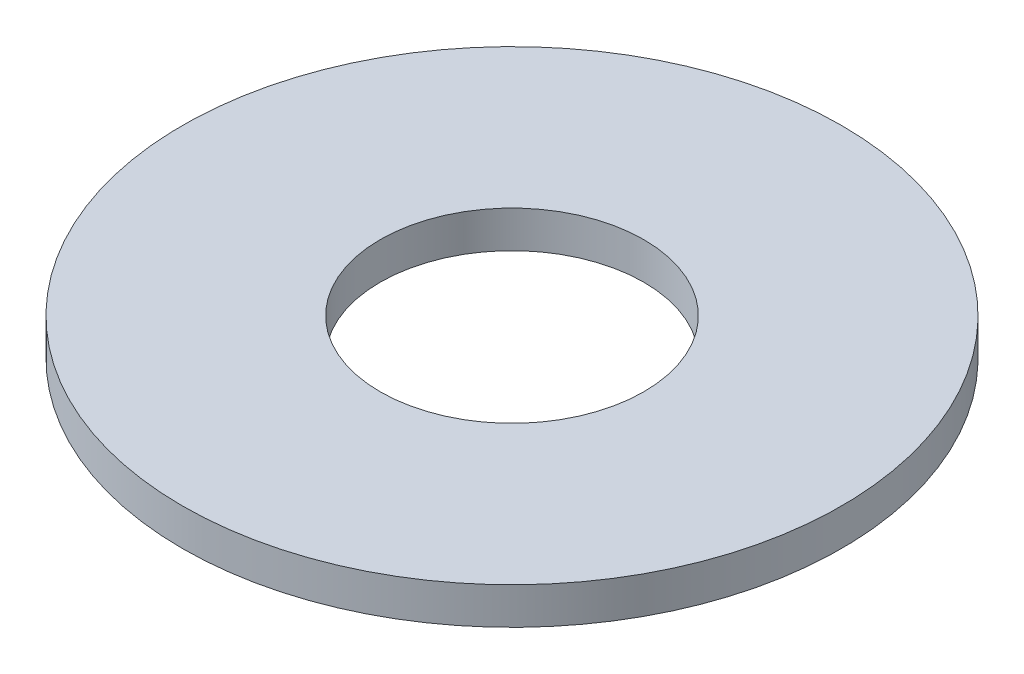
from build123d import *

# Parameters (mm, degrees)
SKETCH1_R           = 62.5
BOSS_EXTRUDE1_DEPTH = 7
SKETCH2_R           = 25
CUT_EXTRUDE1_DEPTH  = 89.665100237


with BuildPart() as part:
    # Sketch1 → Boss-Extrude1 (new body)
    with BuildSketch(Plane(origin=(0, 0, 0), x_dir=(1, 0, 0), z_dir=(0, 1, 0))):
        Circle(SKETCH1_R)
    extrude(amount=BOSS_EXTRUDE1_DEPTH)

    # Sketch2 → Cut-Extrude1 (cut, through all)
    with BuildSketch(Plane(origin=(0, 0, 0), x_dir=(1, 0, 0), z_dir=(0, 1, 0))):
        Circle(SKETCH2_R)
    extrude(amount=CUT_EXTRUDE1_DEPTH, mode=Mode.SUBTRACT)


solid = part.part
